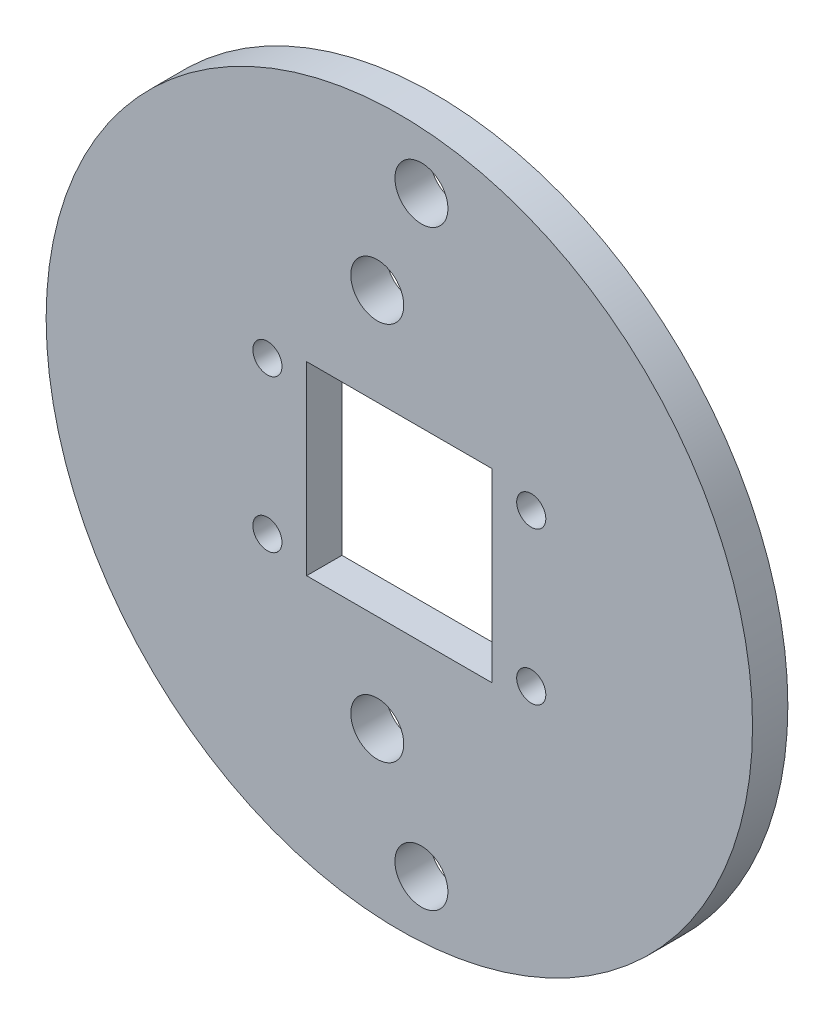
from build123d import *

# Parameters (mm, degrees)
SKETCH_1_R      = 40
SKETCH_1_R_2    = 1.65
SKETCH_1_R_3    = 3
SKETCH_1_W      = 21
SKETCH_1_H      = 21
EXTRUDE_1_DEPTH = 4


with BuildPart() as part:
    # 草图1 → 凸台-拉伸1 (new body)
    with BuildSketch(Plane.XY):
        Circle(SKETCH_1_R)
        with Locations((14.938938215, 8.625)):
            Circle(SKETCH_1_R_2, mode=Mode.SUBTRACT)
        with Locations((14.938938215, -8.625)):
            Circle(SKETCH_1_R_2, mode=Mode.SUBTRACT)
        with Locations((-14.938938215, -8.625)):
            Circle(SKETCH_1_R_2, mode=Mode.SUBTRACT)
        with Locations((-14.938938215, 8.625)):
            Circle(SKETCH_1_R_2, mode=Mode.SUBTRACT)
        with Locations((2.5, 33.5)):
            Circle(SKETCH_1_R_3, mode=Mode.SUBTRACT)
        with Locations((-2.5, 21.5)):
            Circle(SKETCH_1_R_3, mode=Mode.SUBTRACT)
        with Locations((-2.5, -21.5)):
            Circle(SKETCH_1_R_3, mode=Mode.SUBTRACT)
        with Locations((2.5, -33.5)):
            Circle(SKETCH_1_R_3, mode=Mode.SUBTRACT)
        Rectangle(SKETCH_1_W, SKETCH_1_H, mode=Mode.SUBTRACT)
    extrude(amount=EXTRUDE_1_DEPTH)


solid = part.part
